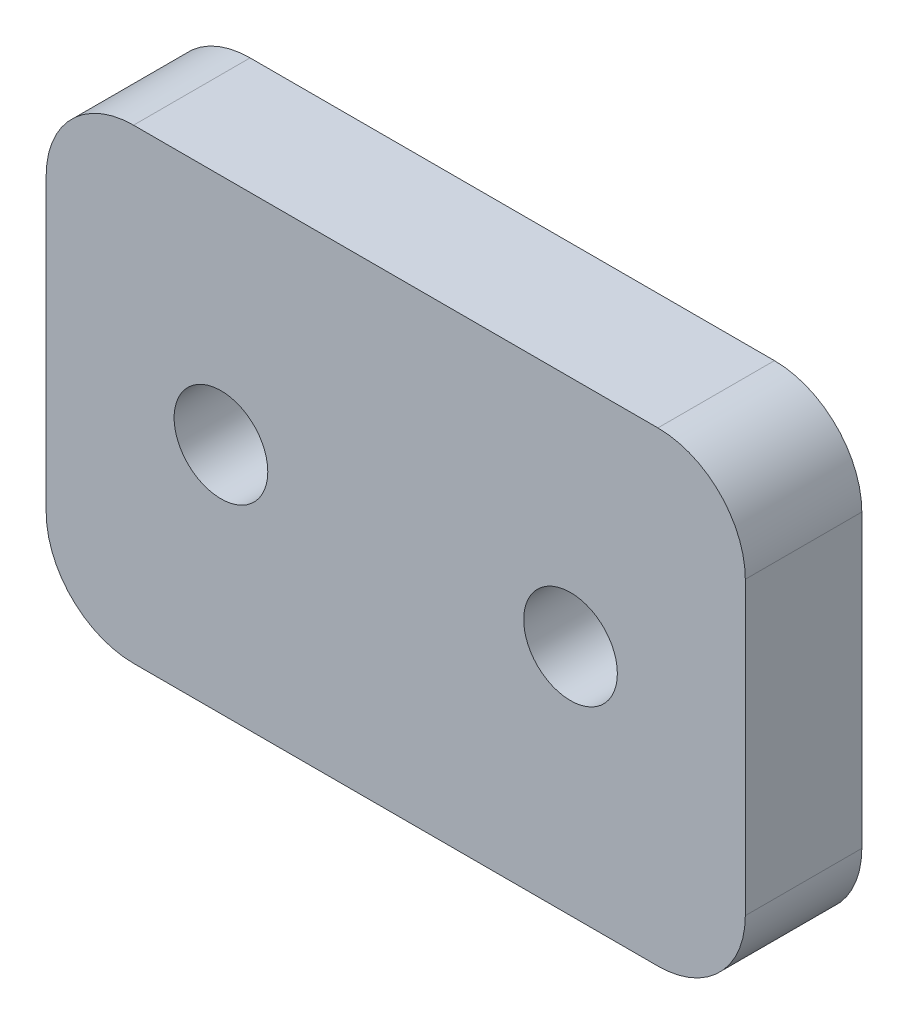
from build123d import *

# Parameters (mm, degrees)
SKETCH2_W           = 38.1
SKETCH2_H           = 25.4
SKETCH2_R           = 2.5527
BOSS_EXTRUDE1_DEPTH = 6.35
FILLET1_R           = 4.7625


with BuildPart() as part:
    # Sketch2 → Boss-Extrude1 (new body)
    with BuildSketch(Plane.XY):
        with Locations((19.05, 12.7)):
            Rectangle(SKETCH2_W, SKETCH2_H)
        with Locations((9.525, 12.7)):
            Circle(SKETCH2_R, mode=Mode.SUBTRACT)
        with Locations((28.575, 12.7)):
            Circle(SKETCH2_R, mode=Mode.SUBTRACT)
    extrude(amount=BOSS_EXTRUDE1_DEPTH)

    # Fillet1
    fillet1_edges = [part.edges().sort_by_distance(p)[0] for p in [
        (0, 25.4, 3.175),
        (0, 0, 3.175),
        (38.1, 0, 3.175),
        (38.1, 25.4, 3.175),
    ]]
    fillet(fillet1_edges, radius=FILLET1_R)


solid = part.part
